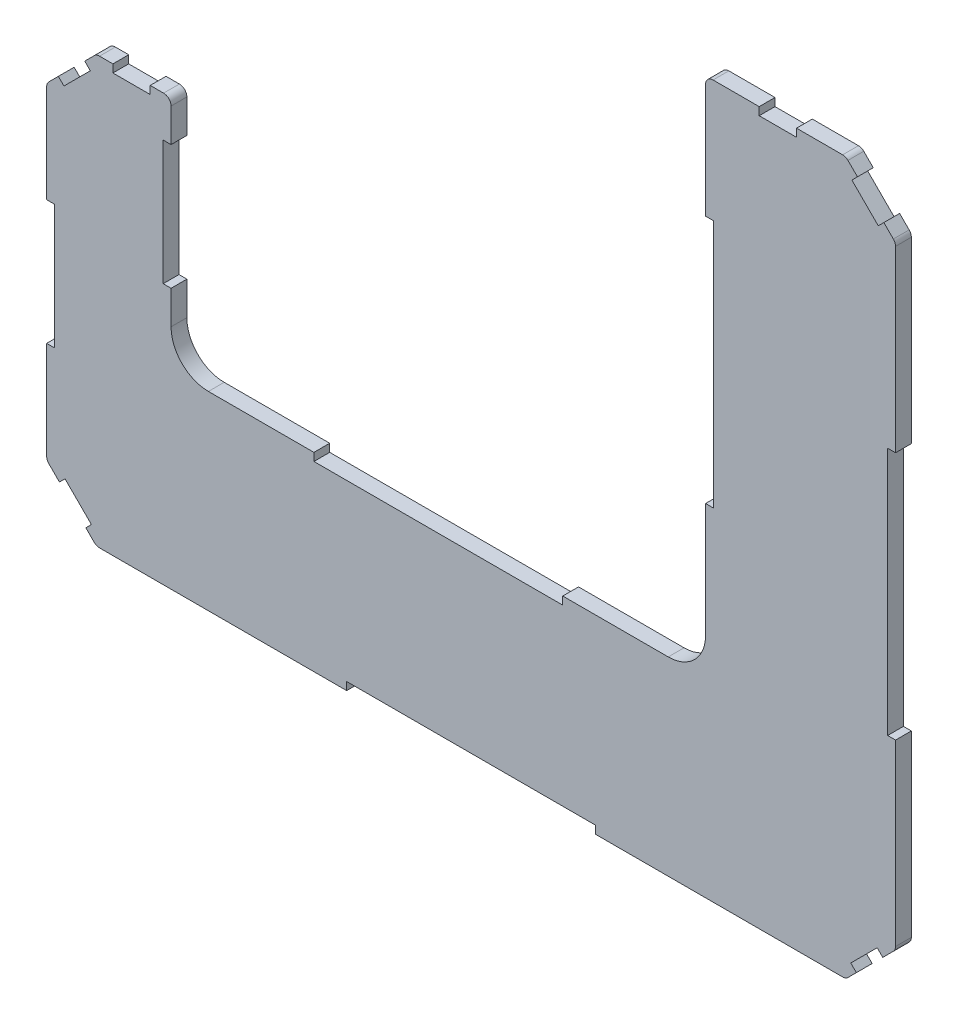
from build123d import *

# Parameters (mm, degrees)
BOSS_EXTRUDE1_DEPTH      = 3.175
BOSS_EXTRUDE1_DEPTH_BACK = 3.175
CHAMFER1_SIZE            = 20
FILLET1_R                = 15
FILLET2_R                = 3
SKETCH4_W                = 15
SKETCH4_H                = 3.175
SKETCH4_W_2              = 3.175
SKETCH4_H_2              = 50
SKETCH4_W_3              = 100
SKETCH4_H_3              = 100
WALL_SLOTS_DEPTH         = 60
FILLET3_R                = 3


with BuildPart() as part:
    # Sketch2 → Boss-Extrude1 (new, two sides: drawn at the far end of the back side and taken through both)
    with BuildSketch(Plane.XY.offset(-BOSS_EXTRUDE1_DEPTH_BACK)):
        Polygon((-157.4125, 94.825), (-107.4125, 94.825), (-107.4125, 0), (107.4125, 0), (107.4125, 209.825), (183.7625, 209.825), (183.7625, -76.35), (58.275, -76.35), (-31.925, -76.35), (-157.4125, -76.35), align=None)
    extrude(amount=BOSS_EXTRUDE1_DEPTH + BOSS_EXTRUDE1_DEPTH_BACK)

    # Chamfer1
    chamfer1_edges = [part.edges().sort_by_distance(p)[0] for p in [
        (-157.4125, -76.35, 0),
        (183.7625, -76.35, 0),
        (183.7625, 209.825, 0),
        (-157.4125, 94.825, 0),
    ]]
    chamfer(chamfer1_edges, length=CHAMFER1_SIZE)

    # Fillet1
    fillet1_edges = [part.edges().sort_by_distance(p)[0] for p in [
        (107.4125, 0, 0),
        (-107.4125, 0, 0),
    ]]
    fillet(fillet1_edges, radius=FILLET1_R)

    # Fillet2
    fillet2_edges = [part.edges().sort_by_distance(p)[0] for p in [
        (183.7625, -56.35, 0),
        (-157.4125, -56.35, 0),
        (-157.4125, 74.825, 0),
        (-137.4125, 94.825, 0),
        (-107.4125, 94.825, 0),
        (183.7625, 189.825, 0),
        (163.7625, 209.825, 0),
        (107.4125, 209.825, 0),
    ]]
    fillet(fillet2_edges, radius=FILLET2_R)

    # Sketch4 → wall_slots (cut)
    with BuildSketch(Plane.XY.offset(3.175)):
        with Locations((136.466179656, 208.2375)):
            Rectangle(SKETCH4_W, SKETCH4_H)
        Polygon((179.065800859, 194.521699141), (168.459199141, 205.128300859), (166.214135111, 202.883236829), (176.820736829, 192.276635111), align=None)
        with Locations((-109, 53.4125)):
            Rectangle(SKETCH4_W_2, SKETCH4_H_2)
        with Locations((-155.825, 9.2375)):
            Rectangle(SKETCH4_W_2, SKETCH4_H_2)
        Polygon((-150.031397, -59.240974939), (-152.276461031, -61.486038969), (-141.669859313, -72.092640687), (-139.424795283, -69.847576657), align=None)
        Polygon((165.774795283, -69.847576657), (168.019859313, -72.092640687), (178.626461031, -61.486038969), (176.381397, -59.240974939), align=None)
        with Locations((13.175, -74.7625)):
            Rectangle(SKETCH4_W_3, SKETCH4_H)
        Polygon((-142.109199141, 90.128300859), (-152.715800859, 79.521699141), (-150.470736829, 77.276635111), (-139.864135111, 87.883236829), align=None)
        with Locations((-123.291179656, 93.2375)):
            Rectangle(SKETCH4_W, SKETCH4_H)
        with Locations((0, -1.5875)):
            Rectangle(SKETCH4_W_3, SKETCH4_H)
        with Locations((109, 110.9125)):
            Rectangle(SKETCH4_W_2, SKETCH4_H_3)
        with Locations((182.175, 66.7375)):
            Rectangle(SKETCH4_W_2, SKETCH4_H_3)
    extrude(amount=-WALL_SLOTS_DEPTH, mode=Mode.SUBTRACT)

    # Fillet3
    fillet3_edges = [part.edges().sort_by_distance(p)[0] for p in [
        (163.7625, -76.35, 0),
        (-137.4125, -76.35, 0),
    ]]
    fillet(fillet3_edges, radius=FILLET3_R)


solid = part.part
